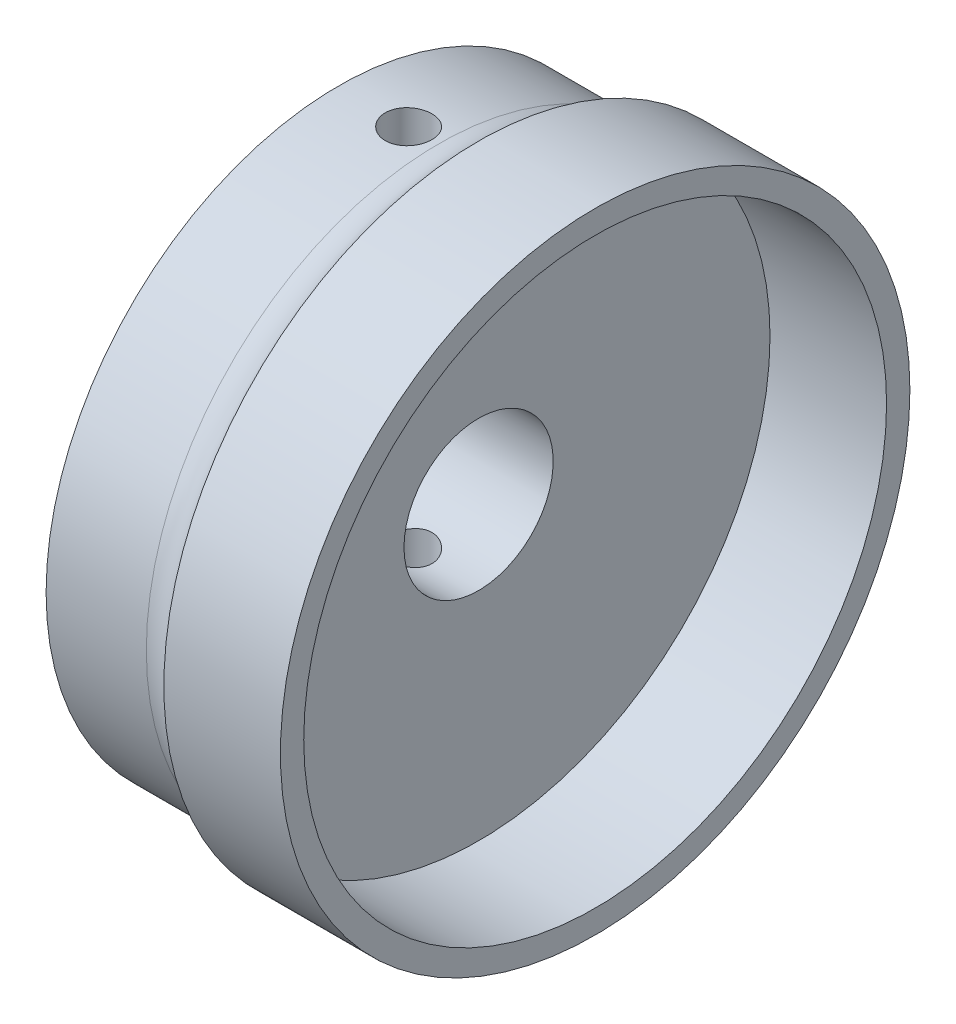
from build123d import *

# Parameters (mm, degrees)
SKETCH_1_R                      = 12.55
EXTRUDE_1_DEPTH                 = 6
SKETCH_2_R                      = 3.2
CUT_EXTRUDE_1_DEPTH             = 6
CUT_EXTRUDE_2_REACH             = 20.735
SKETCH_3_R                      = 1
CUT_EXTRUDE_2_DIRECTION_2_REACH = 20.735
SKETCH_4_R                      = 13.5
EXTRUDE_2_DEPTH                 = 5
SKETCH_5_R                      = 12.5
CUT_EXTRUDE_3_DEPTH             = 5
FILLET_2_R                      = 2


with BuildPart() as part:
    # 草图1 → 凸台-拉伸1 (new body)
    with BuildSketch(Plane(origin=(0, 0, 0), x_dir=(0, 0, -1), z_dir=(1, 0, 0))):
        Circle(SKETCH_1_R)
    extrude(amount=EXTRUDE_1_DEPTH)

    # 草图2 → 切除-拉伸1 (cut)
    with BuildSketch(Plane.ZY):
        Circle(SKETCH_2_R)
    extrude(amount=-CUT_EXTRUDE_1_DEPTH, mode=Mode.SUBTRACT)

    # 草图3 → 切除-拉伸2 (cut, up to next)
    with BuildSketch(Plane(origin=(0, 0, 0), x_dir=(1, 0, 0), z_dir=(0, 1, 0)), mode=Mode.PRIVATE) as cut_extrude_2_sk1:
        with Locations(Location((3, 0, 0), (0, 0, 270))):
            Circle(SKETCH_3_R)
    cut_extrude_2_tool1 = extrude(cut_extrude_2_sk1.sketch, amount=-CUT_EXTRUDE_2_REACH, mode=Mode.PRIVATE) & part.part
    add(cut_extrude_2_tool1.solids().sort_by_distance((3, 0, 0))[0], mode=Mode.SUBTRACT)

    # 草图3 → 切除-拉伸2 direction 2 (cut, up to next)
    with BuildSketch(Plane(origin=(0, 0, 0), x_dir=(1, 0, 0), z_dir=(0, 1, 0)), mode=Mode.PRIVATE) as cut_extrude_2_direction_2_sk1:
        with Locations(Location((3, 0, 0), (0, 0, 270))):
            Circle(SKETCH_3_R)
    cut_extrude_2_direction_2_tool1 = extrude(cut_extrude_2_direction_2_sk1.sketch, amount=CUT_EXTRUDE_2_DIRECTION_2_REACH, mode=Mode.PRIVATE) & part.part
    add(cut_extrude_2_direction_2_tool1.solids().sort_by_distance((3, 0, 0))[0], mode=Mode.SUBTRACT)

    # 草图4 → 凸台-拉伸2 (add)
    with BuildSketch(Plane(origin=(6, 0, 0), x_dir=(0, 0, -1), z_dir=(1, 0, 0))):
        Circle(SKETCH_4_R)
    extrude(amount=EXTRUDE_2_DEPTH)

    # 草图5 → 切除-拉伸3 (cut)
    with BuildSketch(Plane(origin=(11, 0, 0), x_dir=(0, 0, -1), z_dir=(1, 0, 0))):
        Circle(SKETCH_5_R)
    extrude(amount=-CUT_EXTRUDE_3_DEPTH, mode=Mode.SUBTRACT)

    # 圆角2
    # the kernel refuses this fillet: 2 mm, written as the material it adds along each edge
    with BuildSketch(Plane(origin=(6, 0, 0), x_dir=(0, 0, -1), z_dir=(0, -1, 0))) as fillet_2_piece_1:
        with BuildLine():
            CenterArc((14.55, -1.702204453), FILLET_2_R, 121.668243254, 58.331756746)
            Line((12.55, -1.702204453), (12.51, -1.702204453))
            Line((12.51, -1.702204453), (12.51, 0))
            Line((12.51, 0), (12.55, 0.04))
            ThreePointArc((12.55, 0.04), (13.025, 0.04), (13.479, 0.034044089))
            Line((13.479, 0.034044089), (13.5, 0))
        make_face()
    revolve(axis=Axis((6, 0, 0), (1, 0, 0)))


solid = part.part
